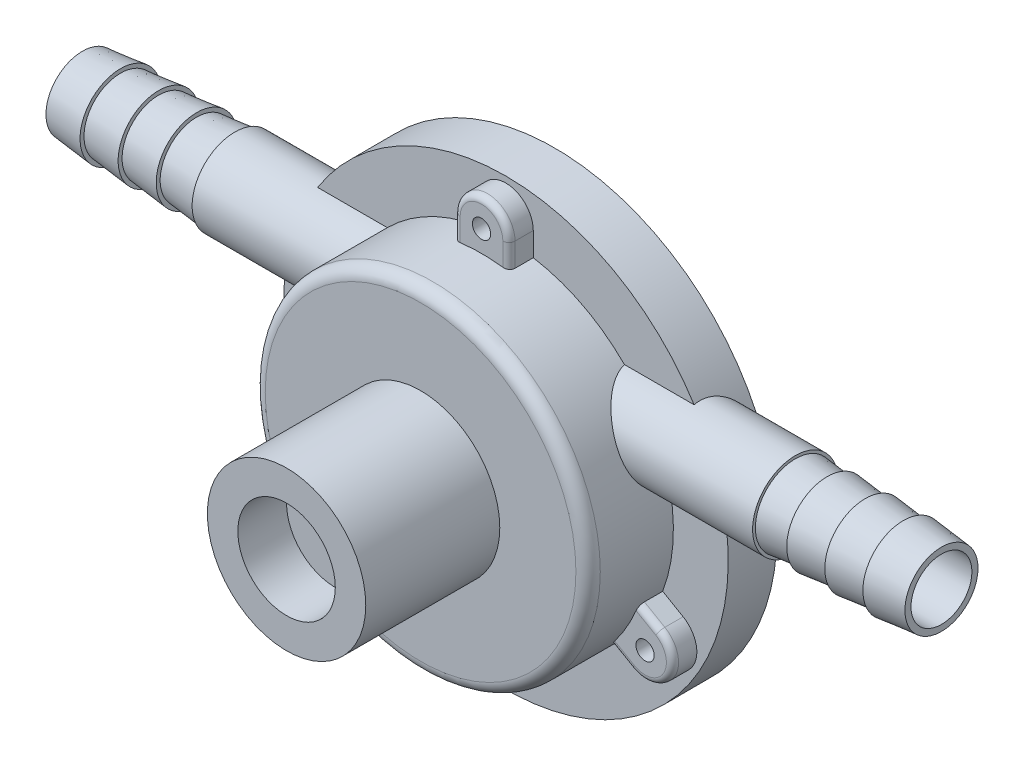
from build123d import *

# Parameters (mm, degrees)
SKETCH1_R                = 36.5
BOSS_EXTRUDE1_DEPTH      = 8
SKETCH2_R                = 27.5
BOSS_EXTRUDE2_DEPTH      = 14
SKETCH3_R                = 13
BOSS_EXTRUDE3_DEPTH      = 22
SKETCH4_R                = 8
CUT_EXTRUDE1_DEPTH       = 8
BOSS_EXTRUDE4_DEPTH      = 10
BOSS_EXTRUDE4_DEPTH_BACK = 82
SKETCH6_R                = 7
CUT_EXTRUDE2_DEPTH       = 12
SKETCH11_R               = 1.5
CUT_EXTRUDE4_DEPTH       = 74.6919264
FILLET1_R                = 2
SKETCH10_R               = 5
CUT_EXTRUDE5_DEPTH       = 109.315511473
SKETCH12_R               = 3.2
CUT_EXTRUDE6_DEPTH       = 70.213438174
SKETCH13_R               = 27.3
SKETCH13_R_2             = 25
CUT_EXTRUDE7_DEPTH       = 1.2
BOSS_EXTRUDE5_DEPTH      = 4
FILLET2_R                = 1
SKETCH15_R               = 1.5
CUT_EXTRUDE8_DEPTH       = 74.6919264
SKETCH17_R               = 5
CUT_EXTRUDE9_DEPTH       = 153.148775898


with BuildPart() as part:
    # Sketch1 → Boss-Extrude1 (new body)
    with BuildSketch(Plane.XY):
        Circle(SKETCH1_R)
    extrude(amount=BOSS_EXTRUDE1_DEPTH)

    # Sketch2 → Boss-Extrude2 (add)
    with BuildSketch(Plane.XY.offset(8)):
        Circle(SKETCH2_R)
    extrude(amount=BOSS_EXTRUDE2_DEPTH)

    # Sketch3 → Boss-Extrude3 (add)
    with BuildSketch(Plane.XY.offset(22)):
        Circle(SKETCH3_R)
    extrude(amount=BOSS_EXTRUDE3_DEPTH)

    # Sketch4 → Cut-Extrude1 (cut)
    with BuildSketch(Plane.XY.offset(44)):
        Circle(SKETCH4_R)
    extrude(amount=-CUT_EXTRUDE1_DEPTH, mode=Mode.SUBTRACT)

    # Sketch6 → Boss-Extrude4 (add, two sides: drawn at the far end of the back side and taken through both)
    with BuildSketch(Plane(origin=(36.5, 0, 0), x_dir=(0, 0, -1), z_dir=(1, 0, 0)).offset(-BOSS_EXTRUDE4_DEPTH_BACK)):
        with Locations((-7, 12.5)):
            Circle(SKETCH6_R)
    extrude(amount=BOSS_EXTRUDE4_DEPTH + BOSS_EXTRUDE4_DEPTH_BACK)

    # Sketch8 → Cut-Extrude2 (cut)
    with BuildSketch(Plane(origin=(0, 0, 0), x_dir=(-1, 0, 0), z_dir=(0, 0, -1))):
        with BuildLine():
            ThreePointArc((-17.653540721, 13.95), (0, -22.5), (17.653540721, 13.95))
            ThreePointArc((17.653540721, 13.95), (0, 18), (-17.653540721, 13.95))
        make_face()
    extrude(amount=-CUT_EXTRUDE2_DEPTH, mode=Mode.SUBTRACT)

    # Sketch11 → Cut-Extrude4 (cut, through all)
    with BuildSketch(Plane(origin=(0, 0, 0), x_dir=(-1, 0, 0), z_dir=(0, 0, -1))):
        with Locations((0, 31)):
            Circle(SKETCH11_R)
        with Locations((26.846787517, -15.5)):
            Circle(SKETCH11_R)
        with Locations((-26.846787517, -15.5)):
            Circle(SKETCH11_R)
    extrude(amount=-CUT_EXTRUDE4_DEPTH, mode=Mode.SUBTRACT)

    # Fillet1
    fillet1_edges = [part.edges().sort_by_distance(p)[0] for p in [
        (-27.5, 0, 22),
    ]]
    fillet(fillet1_edges, radius=FILLET1_R)

    # Sketch10 → Cut-Extrude5 (cut, through all)
    with BuildSketch(Plane(origin=(46.5, 0, 0), x_dir=(0, 0, -1), z_dir=(1, 0, 0))):
        with Locations((-7, 12.5)):
            Circle(SKETCH10_R)
    extrude(amount=-CUT_EXTRUDE5_DEPTH, mode=Mode.SUBTRACT)

    # Sketch12 → Cut-Extrude6 (cut, through all)
    with BuildSketch(Plane.XY.offset(36)):
        Circle(SKETCH12_R)
    extrude(amount=-CUT_EXTRUDE6_DEPTH, mode=Mode.SUBTRACT)

    # Sketch13 → Cut-Extrude7 (cut)
    with BuildSketch(Plane(origin=(0, 0, 0), x_dir=(-1, 0, 0), z_dir=(0, 0, -1))):
        Circle(SKETCH13_R)
        Circle(SKETCH13_R_2, mode=Mode.SUBTRACT)
    extrude(amount=-CUT_EXTRUDE7_DEPTH, mode=Mode.SUBTRACT)

    # Sketch14 → Boss-Extrude5 (add)
    with BuildSketch(Plane.XY.offset(8)):
        with BuildLine():
            Line((4.5, 31), (4.5, 27.129319933))
            ThreePointArc((4.5, 27.129319933), (0, 27.5), (-4.5, 27.129319933))
            Line((-4.5, 27.129319933), (-4.5, 31))
            ThreePointArc((-4.5, 31), (0, 35.5), (4.5, 31))
        make_face()
        with BuildLine():
            Line((29.096787517, -11.602885683), (25.744680249, -9.667545649))
            ThreePointArc((25.744680249, -9.667545649), (23.815698604, -13.75), (21.244680249, -17.461774283))
            Line((21.244680249, -17.461774283), (24.596787517, -19.397114317))
            ThreePointArc((24.596787517, -19.397114317), (30.743901834, -17.75), (29.096787517, -11.602885683))
        make_face()
        with BuildLine():
            Line((-24.596787517, -19.397114317), (-21.244680249, -17.461774283))
            ThreePointArc((-21.244680249, -17.461774283), (-23.815698604, -13.75), (-25.744680249, -9.667545649))
            Line((-25.744680249, -9.667545649), (-29.096787517, -11.602885683))
            ThreePointArc((-29.096787517, -11.602885683), (-30.743901834, -17.75), (-24.596787517, -19.397114317))
        make_face()
    extrude(amount=BOSS_EXTRUDE5_DEPTH)

    # Fillet2
    fillet2_edges = [part.edges().sort_by_distance(p)[0] for p in [
        (4.5, 29.064659966, 12),
        (-4.5, 29.064659966, 12),
        (22.920733883, -18.4294443, 12),
        (27.420733883, -10.635215666, 12),
        (-27.420733883, -10.635215666, 12),
        (-22.920733883, -18.4294443, 12),
        (0, 35.5, 12),
        (30.743901834, -17.75, 12),
        (-30.743901834, -17.75, 12),
    ]]
    fillet(fillet2_edges, radius=FILLET2_R)

    # Sketch15 → Cut-Extrude8 (cut, through all)
    with BuildSketch(Plane(origin=(0, 0, 0), x_dir=(-1, 0, 0), z_dir=(0, 0, -1))):
        with Locations((0, 31)):
            Circle(SKETCH15_R)
        with Locations((26.846787517, -15.5)):
            Circle(SKETCH15_R)
        with Locations((-26.846787517, -15.5)):
            Circle(SKETCH15_R)
    extrude(amount=-CUT_EXTRUDE8_DEPTH, mode=Mode.SUBTRACT)

    # Sketch16 → Revolve1 (revolve)
    with BuildSketch(Plane(origin=(0, 12.5, 0), x_dir=(1, 0, 0), z_dir=(0, 1, 0))):
        Polygon((-70.5, -13), (-64.25, -13.65), (-64.25, -13), (-58, -13.65), (-58, -13), (-51.75, -13.65), (-51.75, -13), (-45.5, -13.65), (-45.5, -7), (-70.5, -7), align=None)
        Polygon((64.25, -13.65), (70.5, -13), (70.5, -7), (45.5, -7), (45.5, -13.65), (51.75, -13), (51.75, -13.65), (58, -13), (58, -13.65), (64.25, -13), align=None)
    revolve(axis=Axis((70.5, 12.5, 7), (-1, 0, 0)))

    # Sketch17 → Cut-Extrude9 (cut, through all)
    with BuildSketch(Plane(origin=(70.5, 0, 0), x_dir=(0, 0, -1), z_dir=(1, 0, 0))):
        with Locations((-7, 12.5)):
            Circle(SKETCH17_R)
    extrude(amount=-CUT_EXTRUDE9_DEPTH, mode=Mode.SUBTRACT)


solid = part.part
